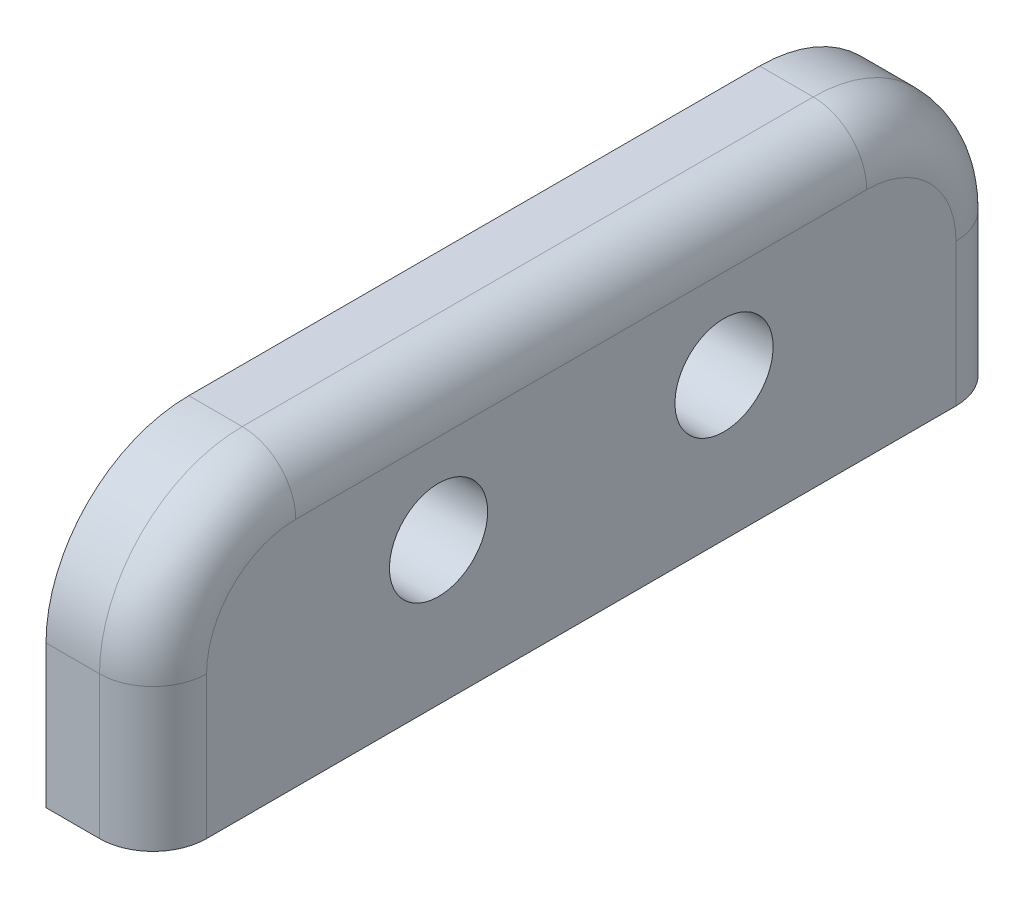
from build123d import *

# Parameters (mm, degrees)
SKETCH1_W           = 48
SKETCH1_H           = 16
SKETCH1_R           = 2.75
BOSS_EXTRUDE1_DEPTH = 6
FILLET1_R           = 8
FILLET2_R           = 3


with BuildPart() as part:
    # Sketch1 → Boss-Extrude1 (new body)
    with BuildSketch(Plane(origin=(0, 0, 0), x_dir=(0, 0, -1), z_dir=(1, 0, 0))):
        Rectangle(SKETCH1_W, SKETCH1_H)
        with Locations((-8, 0)):
            Circle(SKETCH1_R, mode=Mode.SUBTRACT)
        with Locations((8, 0)):
            Circle(SKETCH1_R, mode=Mode.SUBTRACT)
    extrude(amount=BOSS_EXTRUDE1_DEPTH)

    # Fillet1
    fillet1_edges = [part.edges().sort_by_distance(p)[0] for p in [
        (3, 8, 24),
        (3, 8, -24),
    ]]
    fillet(fillet1_edges, radius=FILLET1_R)

    # Fillet2
    fillet2_edges = [part.edges().sort_by_distance(p)[0] for p in [
        (6, -4, -24),
        (6, 5.656854249, -21.656854249),
        (6, -4, 24),
        (6, 5.656854249, 21.656854249),
        (6, 8, 0),
    ]]
    fillet(fillet2_edges, radius=FILLET2_R)


solid = part.part
